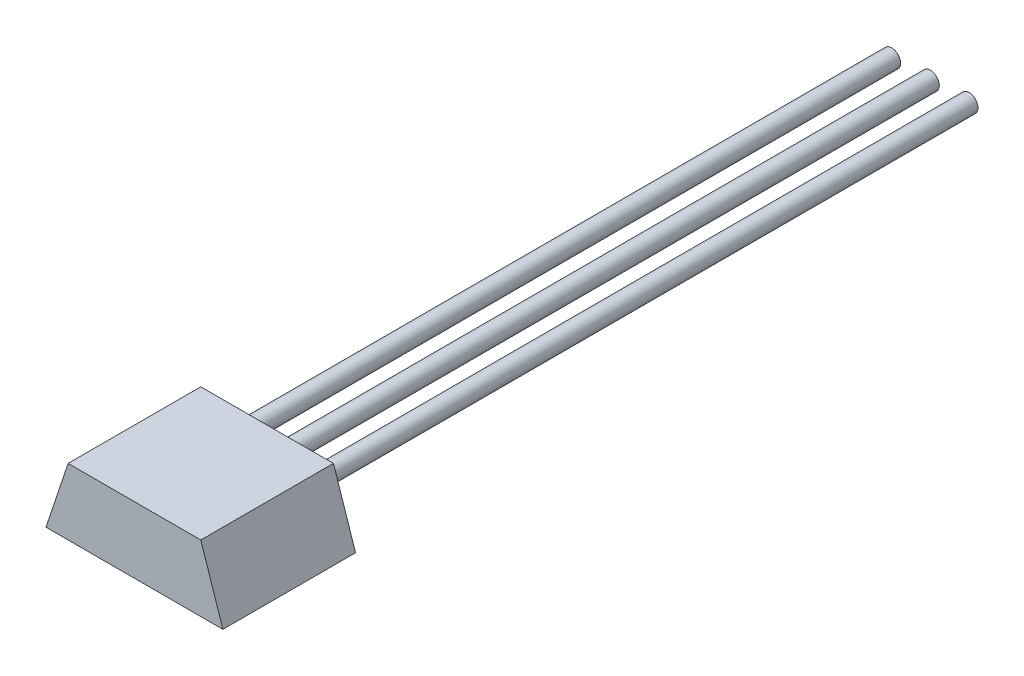
from build123d import *

# Parameters (mm, degrees)
SKETCH1_W           = 4
SKETCH1_H           = 3
BOSS_EXTRUDE1_DEPTH = 1.5
SPLIT1_START        = -1.5
SPLIT1_DEPTH        = 3
SPLIT1_2_DEPTH      = 3
SPLIT1_3_DEPTH      = 3
SKETCH5_R           = 0.2
BOSS_EXTRUDE2_DEPTH = 15


# Read off the part's stored shape, not the designer's step: Split1
with BuildPart() as part:
    # Sketch1 → Boss-Extrude1 (new body)
    with BuildSketch(Plane(origin=(0, 0, 0), x_dir=(1, 0, 0), z_dir=(0, 1, 0))):
        Rectangle(SKETCH1_W, SKETCH1_H)
    extrude(amount=BOSS_EXTRUDE1_DEPTH)

    # Split1 outline → Split1 (cut)
    with BuildSketch(Plane.XY.offset(SPLIT1_START)):
        Polygon((-2, 1.5), (-2, 0), (-1.5, 1.5), align=None)
        Polygon((2, 1.5), (1.5, 1.5), (2, 0), align=None)
    extrude(amount=SPLIT1_DEPTH, mode=Mode.SUBTRACT)

    # Sketch5 → Boss-Extrude2 (add)
    with BuildSketch(Plane(origin=(0, 0, -1.5), x_dir=(-1, 0, 0), z_dir=(0, 0, -1))):
        with Locations(Location((0, 0.75, 0), (0, 0, 180))):
            Circle(SKETCH5_R)
        with Locations(Location((-0.875, 0.75, 0), (0, 0, 180))):
            Circle(SKETCH5_R)
        with Locations(Location((0.875, 0.75, 0), (0, 0, 180))):
            Circle(SKETCH5_R)
    extrude(amount=BOSS_EXTRUDE2_DEPTH)


with BuildPart() as body_2:
    # Split1 2 outline → Split1 2 (new body)
    with BuildSketch(Plane.XY.offset(SPLIT1_START)):
        Polygon((-2, 1.5), (-2, 0), (-1.5, 1.5), align=None)
    extrude(amount=SPLIT1_2_DEPTH)


with BuildPart() as body_3:
    # Split1 3 outline → Split1 3 (new body)
    with BuildSketch(Plane.XY.offset(SPLIT1_START)):
        Polygon((2, 1.5), (1.5, 1.5), (2, 0), align=None)
    extrude(amount=SPLIT1_3_DEPTH)


solid = part.part
